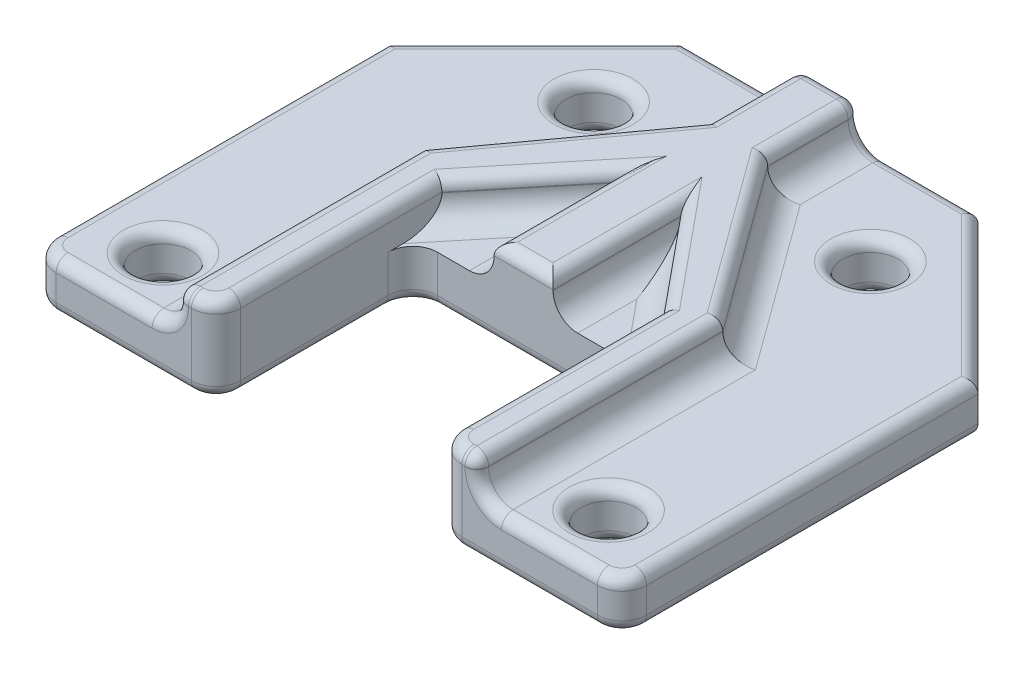
from build123d import *

# Parameters (mm, degrees)
BOSS_EXTRUDE1_DEPTH     = 6.35
F_1_4_CLEARANCE_HOLE1_D = 7.14248
FILLET1_R               = 3.175
BOSS_EXTRUDE2_DEPTH     = 4.7752
CHAMFER1_SIZE           = 19.05
FILLET2_R               = 3.175
FILLET3_R               = 1.524
FILLET4_R               = 1.524


with BuildPart() as part:
    # Sketch1 → Boss-Extrude1 (new body)
    with BuildSketch(Plane(origin=(0, 0, 0), x_dir=(1, 0, 0), z_dir=(0, 1, 0))):
        Polygon((-38.1, 0), (-14.2875, 0), (-14.2875, 25.4), (14.2875, 25.4), (14.2875, 0), (38.1, 0), (38.1, 65), (-38.1, 65), align=None)
    extrude(amount=BOSS_EXTRUDE1_DEPTH)

    # 1/4 Clearance Hole1 (through all)
    with Locations(Plane(origin=(0, 6.35, 0), x_dir=(1, 0, 0), z_dir=(0, 1, 0))):
        with Locations((-28.75, 7.62), (28.75, 7.62), (17.862477609, 52.3), (-17.862477609, 52.3)):
            Hole(F_1_4_CLEARANCE_HOLE1_D / 2)

    # Fillet1
    fillet1_edges = [part.edges().sort_by_distance(p)[0] for p in [
        (14.2875, 3.175, -25.4),
        (-14.2875, 3.175, -25.4),
    ]]
    fillet(fillet1_edges, radius=FILLET1_R)

    # Sketch4 → Boss-Extrude2 (add)
    with BuildSketch(Plane(origin=(0, 6.35, 0), x_dir=(1, 0, 0), z_dir=(0, 1, 0))):
        Polygon((-14.2875, 29.150607626), (-3.81, 41.91), (-3.81, 25.4), (3.81, 25.4), (3.81, 41.91), (14.2875, 29.150607626), (14.2875, 0), (19.3675, 0), (19.3675, 31.75), (3.81, 53.098752885), (3.81, 65), (-3.81, 65), (-3.81, 53.098752885), (-19.3675, 31.75), (-19.3675, 0), (-14.2875, 0), align=None)
    extrude(amount=BOSS_EXTRUDE2_DEPTH)

    # Chamfer1
    chamfer1_edges = [part.edges().sort_by_distance(p)[0] for p in [
        (-38.1, 3.175, -65),
        (38.1, 3.175, -65),
    ]]
    chamfer(chamfer1_edges, length=CHAMFER1_SIZE)

    # Fillet2
    fillet2_edges = [part.edges().sort_by_distance(p)[0] for p in [
        (38.1, 3.175, 0),
        (14.2875, 5.5626, 0),
        (-14.2875, 5.5626, 0),
        (-38.1, 3.175, 0),
        (-9.04875, 6.35, -35.530303813),
        (-3.81, 6.35, -33.655),
        (3.81, 6.35, -33.655),
        (9.04875, 6.35, -35.530303813),
        (19.3675, 6.35, -15.875),
        (11.58875, 6.35, -42.424376443),
        (3.81, 6.35, -59.049376443),
        (-3.81, 6.35, -59.049376443),
        (-11.58875, 6.35, -42.424376443),
        (-19.3675, 6.35, -15.875),
    ]]
    fillet(fillet2_edges, radius=FILLET2_R)

    # Fillet3
    fillet3_edges = [part.edges().sort_by_distance(p)[0] for p in [
        (18.415, 11.1252, 0),
        (-14.2875, 11.1252, -16.162803813),
        (-15.21743597, 11.1252, -0.92993597),
        (15.21743597, 11.1252, -0.92993597),
        (-9.04875, 11.1252, -35.530303813),
        (-3.81, 11.1252, -33.655),
        (0, 11.1252, -25.4),
        (3.81, 11.1252, -33.655),
        (9.04875, 11.1252, -35.530303813),
        (14.2875, 11.1252, -16.162803813),
        (19.3675, 11.1252, -15.875),
        (11.58875, 11.1252, -42.424376443),
        (3.81, 11.1252, -59.049376443),
        (0, 11.1252, -65),
        (-3.81, 11.1252, -59.049376443),
        (-11.58875, 11.1252, -42.424376443),
        (-19.3675, 11.1252, -15.875),
        (-18.415, 11.1252, 0),
    ]]
    fillet(fillet3_edges, radius=FILLET3_R)

    # Fillet4
    # the kernel refuses this fillet: 1.524 mm, written as the material it takes off along each edge
    with BuildSketch(Plane(origin=(17.8435, 9.6012, -1.524), x_dir=(1, 0, 0), z_dir=(0, 0, 1))) as fillet4_piece_1_section:
        Polygon((0, 0), (FILLET4_R, 0), (FILLET4_R, FILLET4_R), (0, FILLET4_R), align=None)
    fillet4_piece_1 = extrude(amount=FILLET4_R, mode=Mode.PRIVATE)
    fillet4_piece_1 = fillet4_piece_1 - Plane(origin=(17.8435, 9.6012, -1.524), x_dir=(-0.7071067811865475, -0.7071067811865475, 0), z_dir=(0, 0, 1)) * Sphere(FILLET4_R, mode=Mode.PRIVATE)
    add(fillet4_piece_1, mode=Mode.SUBTRACT)
    with BuildSketch(Plane(origin=(2.286, 9.6012, -63.476), x_dir=(1, 0, 0), z_dir=(0, 0, -1))) as fillet4_piece_2_section:
        Polygon((0, 0), (FILLET4_R, 0), (FILLET4_R, -FILLET4_R), (0, -FILLET4_R), align=None)
    fillet4_piece_2 = extrude(amount=FILLET4_R, mode=Mode.PRIVATE)
    fillet4_piece_2 = fillet4_piece_2 - Plane(origin=(2.286, 9.6012, -63.476), x_dir=(-0.7071067811865475, -0.7071067811865475, 0), z_dir=(0, 0, -1)) * Sphere(FILLET4_R, mode=Mode.PRIVATE)
    add(fillet4_piece_2, mode=Mode.SUBTRACT)
    with BuildSketch(Plane(origin=(-2.286, 9.6012, -63.476), x_dir=(-1, 0, 0), z_dir=(0, 0, -1))) as fillet4_piece_3_section:
        Polygon((0, 0), (FILLET4_R, 0), (FILLET4_R, FILLET4_R), (0, FILLET4_R), align=None)
    fillet4_piece_3 = extrude(amount=FILLET4_R, mode=Mode.PRIVATE)
    fillet4_piece_3 = fillet4_piece_3 - Plane(origin=(-2.286, 9.6012, -63.476), x_dir=(0.7071067811865475, -0.7071067811865475, 0), z_dir=(0, 0, -1)) * Sphere(FILLET4_R, mode=Mode.PRIVATE)
    add(fillet4_piece_3, mode=Mode.SUBTRACT)
    with BuildSketch(Plane(origin=(-17.8435, 9.6012, -1.524), x_dir=(-1, 0, 0), z_dir=(0, 0, 1))) as fillet4_piece_4_section:
        Polygon((0, 0), (FILLET4_R, 0), (FILLET4_R, -FILLET4_R), (0, -FILLET4_R), align=None)
    fillet4_piece_4 = extrude(amount=FILLET4_R, mode=Mode.PRIVATE)
    fillet4_piece_4 = fillet4_piece_4 - Plane(origin=(-17.8435, 9.6012, -1.524), x_dir=(0.7071067811865475, -0.7071067811865475, 0), z_dir=(0, 0, 1)) * Sphere(FILLET4_R, mode=Mode.PRIVATE)
    add(fillet4_piece_4, mode=Mode.SUBTRACT)
    with BuildSketch(Plane(origin=(-38.1, 0, -49.76), x_dir=(1, 0, 0), z_dir=(0, 0, 1)), Plane(origin=(38.1, 0, -3.175), x_dir=(-1, 0, 0), z_dir=(0, 0, -1)), Plane(origin=(38.1, 6.35, -3.175), x_dir=(0, -1, 0), z_dir=(0, 0, -1))) as fillet4_piece_5:
        with BuildLine():
            CenterArc((FILLET4_R, FILLET4_R), FILLET4_R, 180, 90)
            Line((0, FILLET4_R), (0, 0))
            Line((0, 0), (FILLET4_R, 0))
        make_face()
    extrude(amount=46.585, mode=Mode.SUBTRACT)
    with BuildSketch(Plane(origin=(-38.1, 6.35, -49.76), x_dir=(1, 0, 0), z_dir=(0, 0, 1))) as fillet4_piece_6:
        with BuildLine():
            CenterArc((FILLET4_R, -FILLET4_R), FILLET4_R, 90, 90)
            Line((0, -FILLET4_R), (0, 0))
            Line((0, 0), (FILLET4_R, 0))
        make_face()
    extrude(amount=46.585, mode=Mode.SUBTRACT)
    with BuildSketch(Plane(origin=(22.86, 0, -65), x_dir=(0, 0, 1), z_dir=(-1, 0, 0))) as fillet4_piece_7:
        with BuildLine():
            CenterArc((FILLET4_R, FILLET4_R), FILLET4_R, 180, 90)
            Line((0, FILLET4_R), (0, 0))
            Line((0, 0), (FILLET4_R, 0))
        make_face()
    extrude(amount=45.72, mode=Mode.SUBTRACT)
    with BuildSketch(Plane(origin=(40.794076836, 0, -43.255923164), x_dir=(-0.7071067811865475, 0, 0.7071067811865475), z_dir=(-0.7071067811865476, 0, -0.7071067811865475)), Plane(origin=(-16.355923164, 0, -67.694076836), x_dir=(0.7071067811865475, 0, 0.7071067811865475), z_dir=(-0.7071067811865476, 0, 0.7071067811865475)), Plane(origin=(40.794076836, 6.35, -43.255923164), x_dir=(0, -1, 0), z_dir=(-0.7071067811865476, 0, -0.7071067811865475))) as fillet4_piece_8:
        with BuildLine():
            CenterArc((FILLET4_R, FILLET4_R), FILLET4_R, 180, 90)
            Line((0, FILLET4_R), (0, 0))
            Line((0, 0), (FILLET4_R, 0))
        make_face()
    extrude(amount=34.560768363, mode=Mode.SUBTRACT)
    with BuildSketch(Plane(origin=(22.86, 6.35, -65), x_dir=(0, -1, 0), z_dir=(-1, 0, 0))) as fillet4_piece_9:
        with BuildLine():
            CenterArc((FILLET4_R, FILLET4_R), FILLET4_R, 180, 90)
            Line((0, FILLET4_R), (0, 0))
            Line((0, 0), (FILLET4_R, 0))
        make_face()
    extrude(amount=15.875, mode=Mode.SUBTRACT)
    with BuildSketch(Plane(origin=(-16.355923164, 6.35, -67.694076836), x_dir=(0.7071067811865475, 0, 0.7071067811865475), z_dir=(-0.7071067811865476, 0, 0.7071067811865475))) as fillet4_piece_10:
        with BuildLine():
            CenterArc((FILLET4_R, -FILLET4_R), FILLET4_R, 90, 90)
            Line((0, -FILLET4_R), (0, 0))
            Line((0, 0), (FILLET4_R, 0))
        make_face()
    extrude(amount=34.560768363, mode=Mode.SUBTRACT)
    with BuildSketch(Plane(origin=(17.4625, 0, 0), x_dir=(0, 0, -1), z_dir=(1, 0, 0))) as fillet4_piece_11:
        with BuildLine():
            CenterArc((FILLET4_R, FILLET4_R), FILLET4_R, 180, 90)
            Line((0, FILLET4_R), (0, 0))
            Line((0, 0), (FILLET4_R, 0))
        make_face()
    extrude(amount=17.4625, mode=Mode.SUBTRACT)
    with BuildSketch(Plane(origin=(22.5425, 6.35, 0), x_dir=(0, -1, 0), z_dir=(1, 0, 0)), Plane(origin=(-34.925, 6.35, 0), x_dir=(0, -1, 0), z_dir=(1, 0, 0))) as fillet4_piece_12:
        with BuildLine():
            CenterArc((FILLET4_R, FILLET4_R), FILLET4_R, 180, 90)
            Line((0, FILLET4_R), (0, 0))
            Line((0, 0), (FILLET4_R, 0))
        make_face()
    extrude(amount=12.3825, mode=Mode.SUBTRACT)
    with BuildSketch(Plane(origin=(-14.2875, 0, -3.175), x_dir=(-1, 0, 0), z_dir=(0, 0, -1)), Plane(origin=(14.2875, 0, -22.225), x_dir=(1, 0, 0), z_dir=(0, 0, 1))) as fillet4_piece_13:
        with BuildLine():
            CenterArc((FILLET4_R, FILLET4_R), FILLET4_R, 180, 90)
            Line((0, FILLET4_R), (0, 0))
            Line((0, 0), (FILLET4_R, 0))
        make_face()
    extrude(amount=19.05, mode=Mode.SUBTRACT)
    with BuildSketch(Plane(origin=(-34.925, 0, 0), x_dir=(0, 1, 0), z_dir=(1, 0, 0))) as fillet4_piece_14:
        with BuildLine():
            CenterArc((FILLET4_R, -FILLET4_R), FILLET4_R, 90, 90)
            Line((0, -FILLET4_R), (0, 0))
            Line((0, 0), (FILLET4_R, 0))
        make_face()
    extrude(amount=17.4625, mode=Mode.SUBTRACT)
    with BuildSketch(Plane(origin=(-34.925, 0, -3.175), x_dir=(-1, 0, 0), z_dir=(0, 0, -1))) as fillet4_piece_15:
        with BuildLine():
            CenterArc((3.175 - FILLET4_R, FILLET4_R), FILLET4_R, 270, 90)
            Line((3.175, FILLET4_R), (3.175, 0))
            Line((3.175, 0), (3.175 - FILLET4_R, 0))
        make_face()
    revolve(axis=Axis((-34.925, 0, -3.175), (0, 1, 0)), revolution_arc=90, mode=Mode.SUBTRACT)
    with BuildSketch(Plane(origin=(34.925, 0, -3.175), x_dir=(1, 0, 0), z_dir=(0, 0, -1))) as fillet4_piece_16:
        with BuildLine():
            CenterArc((3.175 - FILLET4_R, -FILLET4_R), FILLET4_R, 0, 90)
            Line((3.175, -FILLET4_R), (3.175, 0))
            Line((3.175, 0), (3.175 - FILLET4_R, 0))
        make_face()
    revolve(axis=Axis((34.925, 0, -3.175), (0, -1, 0)), revolution_arc=90, mode=Mode.SUBTRACT)
    with BuildSketch(Plane(origin=(-17.4625, 0, -3.175), x_dir=(0, 0, 1), z_dir=(-1, 0, 0))) as fillet4_piece_17:
        with BuildLine():
            CenterArc((3.175 - FILLET4_R, FILLET4_R), FILLET4_R, 270, 90)
            Line((3.175 - FILLET4_R, 0), (3.175, 0))
            Line((3.175, 0), (3.175, FILLET4_R))
        make_face()
    revolve(axis=Axis((-17.4625, 0, -3.175), (0, 1, 0)), revolution_arc=90, mode=Mode.SUBTRACT)
    with BuildSketch(Plane(origin=(17.4625, 0, -3.175), x_dir=(0, 0, 1), z_dir=(1, 0, 0))) as fillet4_piece_18:
        with BuildLine():
            CenterArc((3.175 - FILLET4_R, -FILLET4_R), FILLET4_R, 0, 90)
            Line((3.175, -FILLET4_R), (3.175, 0))
            Line((3.175, 0), (3.175 - FILLET4_R, 0))
        make_face()
    revolve(axis=Axis((17.4625, 0, -3.175), (0, -1, 0)), revolution_arc=90, mode=Mode.SUBTRACT)
    with BuildSketch(Plane(origin=(34.925, 6.35, -3.175), x_dir=(1, 0, 0), z_dir=(0, 0, -1))) as fillet4_piece_19:
        with BuildLine():
            CenterArc((3.175 - FILLET4_R, FILLET4_R), FILLET4_R, 270, 90)
            Line((3.175 - FILLET4_R, 0), (3.175, 0))
            Line((3.175, 0), (3.175, FILLET4_R))
        make_face()
    revolve(axis=Axis((34.925, 6.35, -3.175), (0, -1, 0)), revolution_arc=90, mode=Mode.SUBTRACT)
    with BuildSketch(Plane(origin=(-6.985, 6.35, -65), x_dir=(0, 0, 1), z_dir=(-1, 0, 0))) as fillet4_piece_20:
        with BuildLine():
            CenterArc((FILLET4_R, -FILLET4_R), FILLET4_R, 90, 90)
            Line((0, -FILLET4_R), (0, 0))
            Line((0, 0), (FILLET4_R, 0))
        make_face()
    extrude(amount=15.875, mode=Mode.SUBTRACT)
    with BuildSketch(Plane(origin=(-34.925, 6.35, -3.175), x_dir=(-1, 0, 0), z_dir=(0, 0, -1))) as fillet4_piece_21:
        with BuildLine():
            CenterArc((3.175 - FILLET4_R, -FILLET4_R), FILLET4_R, 0, 90)
            Line((3.175, -FILLET4_R), (3.175, 0))
            Line((3.175, 0), (3.175 - FILLET4_R, 0))
        make_face()
    revolve(axis=Axis((-34.925, 6.35, -3.175), (0, 1, 0)), revolution_arc=90, mode=Mode.SUBTRACT)
    with BuildSketch(Plane(origin=(22.5425, 9.525, 0), x_dir=(0, -1, 0), z_dir=(1, 0, 0))) as fillet4_piece_22:
        with BuildLine():
            CenterArc((3.175 + FILLET4_R, FILLET4_R), FILLET4_R, 180, 90)
            Line((3.175, FILLET4_R), (3.175, 0))
            Line((3.175, 0), (3.175 + FILLET4_R, 0))
        make_face()
    revolve(axis=Axis((22.5425, 9.525, 0), (0, 0, -1)), revolution_arc=90, mode=Mode.SUBTRACT)
    with BuildSketch(Plane(origin=(6.985, 9.525, -65), x_dir=(0, -1, 0), z_dir=(1, 0, 0))) as fillet4_piece_23:
        with BuildLine():
            CenterArc((3.175 + FILLET4_R, -FILLET4_R), FILLET4_R, 90, 90)
            Line((3.175, -FILLET4_R), (3.175, 0))
            Line((3.175, 0), (3.175 + FILLET4_R, 0))
        make_face()
    revolve(axis=Axis((6.985, 9.525, -65), (0, 0, -1)), revolution_arc=90, mode=Mode.SUBTRACT)
    with BuildSketch(Plane(origin=(-6.985, 9.525, -65), x_dir=(0, -1, 0), z_dir=(-1, 0, 0))) as fillet4_piece_24:
        with BuildLine():
            CenterArc((3.175 + FILLET4_R, FILLET4_R), FILLET4_R, 180, 90)
            Line((3.175, FILLET4_R), (3.175, 0))
            Line((3.175, 0), (3.175 + FILLET4_R, 0))
        make_face()
    revolve(axis=Axis((-6.985, 9.525, -65), (0, 0, 1)), revolution_arc=90, mode=Mode.SUBTRACT)
    with BuildSketch(Plane(origin=(-22.5425, 9.525, 0), x_dir=(0, -1, 0), z_dir=(-1, 0, 0))) as fillet4_piece_25:
        with BuildLine():
            CenterArc((3.175 + FILLET4_R, -FILLET4_R), FILLET4_R, 90, 90)
            Line((3.175, -FILLET4_R), (3.175, 0))
            Line((3.175, 0), (3.175 + FILLET4_R, 0))
        make_face()
    revolve(axis=Axis((-22.5425, 9.525, 0), (0, 0, 1)), revolution_arc=90, mode=Mode.SUBTRACT)
    with BuildSketch(Plane(origin=(-19.3675, 9.525, 0), x_dir=(1, 0, 0), z_dir=(0, 1, 0)), Plane(origin=(3.81, 9.525, -65), x_dir=(-1, 0, 0), z_dir=(0, 1, 0))) as fillet4_piece_26:
        with BuildLine():
            CenterArc((FILLET4_R, FILLET4_R), FILLET4_R, 180, 90)
            Line((0, FILLET4_R), (0, 0))
            Line((0, 0), (FILLET4_R, 0))
        make_face()
    extrude(amount=0.0762, mode=Mode.SUBTRACT)
    with BuildSketch(Plane(origin=(19.3675, 9.525, 0), x_dir=(-1, 0, 0), z_dir=(0, 1, 0)), Plane(origin=(-3.81, 9.525, -65), x_dir=(1, 0, 0), z_dir=(0, 1, 0))) as fillet4_piece_27:
        with BuildLine():
            CenterArc((FILLET4_R, -FILLET4_R), FILLET4_R, 90, 90)
            Line((0, -FILLET4_R), (0, 0))
            Line((0, 0), (FILLET4_R, 0))
        make_face()
    extrude(amount=0.0762, mode=Mode.SUBTRACT)
    with BuildSketch(Plane(origin=(-17.862477609, 6.35, -52.3), x_dir=(-1, 0, 0), z_dir=(0, 0, 1))) as fillet4_piece_28:
        with BuildLine():
            CenterArc((3.57124 + FILLET4_R, FILLET4_R), FILLET4_R, 180, 90)
            Line((3.57124, FILLET4_R), (3.57124, 0))
            Line((3.57124, 0), (3.57124 + FILLET4_R, 0))
        make_face()
    revolve(axis=Axis((-17.862477609, 6.35, -52.3), (0, -1, 0)), mode=Mode.SUBTRACT)
    with BuildSketch(Plane(origin=(-17.862477609, 0, -52.3), x_dir=(-1, 0, 0), z_dir=(0, 0, 1))) as fillet4_piece_29:
        with BuildLine():
            CenterArc((3.57124 + FILLET4_R, -FILLET4_R), FILLET4_R, 90, 90)
            Line((3.57124, -FILLET4_R), (3.57124, 0))
            Line((3.57124, 0), (3.57124 + FILLET4_R, 0))
        make_face()
    revolve(axis=Axis((-17.862477609, 0, -52.3), (0, -1, 0)), mode=Mode.SUBTRACT)
    with BuildSketch(Plane(origin=(17.862477609, 6.35, -52.3), x_dir=(-1, 0, 0), z_dir=(0, 0, 1))) as fillet4_piece_30:
        with BuildLine():
            CenterArc((3.57124 + FILLET4_R, FILLET4_R), FILLET4_R, 180, 90)
            Line((3.57124 + FILLET4_R, 0), (3.57124, 0))
            Line((3.57124, 0), (3.57124, FILLET4_R))
        make_face()
    revolve(axis=Axis((17.862477609, 6.35, -52.3), (0, -1, 0)), mode=Mode.SUBTRACT)
    with BuildSketch(Plane(origin=(17.862477609, 0, -52.3), x_dir=(-1, 0, 0), z_dir=(0, 0, 1))) as fillet4_piece_31:
        with BuildLine():
            CenterArc((3.57124 + FILLET4_R, -FILLET4_R), FILLET4_R, 90, 90)
            Line((3.57124, -FILLET4_R), (3.57124, 0))
            Line((3.57124, 0), (3.57124 + FILLET4_R, 0))
        make_face()
    revolve(axis=Axis((17.862477609, 0, -52.3), (0, -1, 0)), mode=Mode.SUBTRACT)
    with BuildSketch(Plane(origin=(28.75, 6.35, -7.62), x_dir=(-1, 0, 0), z_dir=(0, 0, 1))) as fillet4_piece_32:
        with BuildLine():
            CenterArc((3.57124 + FILLET4_R, FILLET4_R), FILLET4_R, 180, 90)
            Line((3.57124 + FILLET4_R, 0), (3.57124, 0))
            Line((3.57124, 0), (3.57124, FILLET4_R))
        make_face()
    revolve(axis=Axis((28.75, 6.35, -7.62), (0, -1, 0)), mode=Mode.SUBTRACT)
    with BuildSketch(Plane(origin=(28.75, 0, -7.62), x_dir=(-1, 0, 0), z_dir=(0, 0, 1))) as fillet4_piece_33:
        with BuildLine():
            CenterArc((3.57124 + FILLET4_R, -FILLET4_R), FILLET4_R, 90, 90)
            Line((3.57124, -FILLET4_R), (3.57124, 0))
            Line((3.57124, 0), (3.57124 + FILLET4_R, 0))
        make_face()
    revolve(axis=Axis((28.75, 0, -7.62), (0, -1, 0)), mode=Mode.SUBTRACT)
    with BuildSketch(Plane(origin=(-28.75, 6.35, -7.62), x_dir=(-1, 0, 0), z_dir=(0, 0, 1))) as fillet4_piece_34:
        with BuildLine():
            CenterArc((3.57124 + FILLET4_R, FILLET4_R), FILLET4_R, 180, 90)
            Line((3.57124, FILLET4_R), (3.57124, 0))
            Line((3.57124, 0), (3.57124 + FILLET4_R, 0))
        make_face()
    revolve(axis=Axis((-28.75, 6.35, -7.62), (0, -1, 0)), mode=Mode.SUBTRACT)
    with BuildSketch(Plane(origin=(-28.75, 0, -7.62), x_dir=(-1, 0, 0), z_dir=(0, 0, 1))) as fillet4_piece_35:
        with BuildLine():
            CenterArc((3.57124 + FILLET4_R, -FILLET4_R), FILLET4_R, 90, 90)
            Line((3.57124, -FILLET4_R), (3.57124, 0))
            Line((3.57124, 0), (3.57124 + FILLET4_R, 0))
        make_face()
    revolve(axis=Axis((-28.75, 0, -7.62), (0, -1, 0)), mode=Mode.SUBTRACT)
    with BuildSketch(Plane(origin=(-11.1125, 0, -25.4), x_dir=(0, 0, -1), z_dir=(1, 0, 0))) as fillet4_piece_36:
        with BuildLine():
            CenterArc((FILLET4_R, FILLET4_R), FILLET4_R, 180, 90)
            Line((0, FILLET4_R), (0, 0))
            Line((0, 0), (FILLET4_R, 0))
        make_face()
    extrude(amount=22.225, mode=Mode.SUBTRACT)
    with BuildSketch(Plane(origin=(11.1125, 0, -22.225), x_dir=(0, 0, -1), z_dir=(-1, 0, 0))) as fillet4_piece_37:
        with BuildLine():
            CenterArc((3.175 + FILLET4_R, -FILLET4_R), FILLET4_R, 90, 90)
            Line((3.175, -FILLET4_R), (3.175, 0))
            Line((3.175, 0), (3.175 + FILLET4_R, 0))
        make_face()
    revolve(axis=Axis((11.1125, 0, -22.225), (0, -1, 0)), revolution_arc=90, mode=Mode.SUBTRACT)
    with BuildSketch(Plane(origin=(-11.1125, 0, -22.225), x_dir=(-1, 0, 0), z_dir=(0, 0, 1))) as fillet4_piece_38:
        with BuildLine():
            CenterArc((3.175 + FILLET4_R, -FILLET4_R), FILLET4_R, 90, 90)
            Line((3.175, -FILLET4_R), (3.175, 0))
            Line((3.175, 0), (3.175 + FILLET4_R, 0))
        make_face()
    revolve(axis=Axis((-11.1125, 0, -22.225), (0, -1, 0)), revolution_arc=90, mode=Mode.SUBTRACT)


solid = part.part
